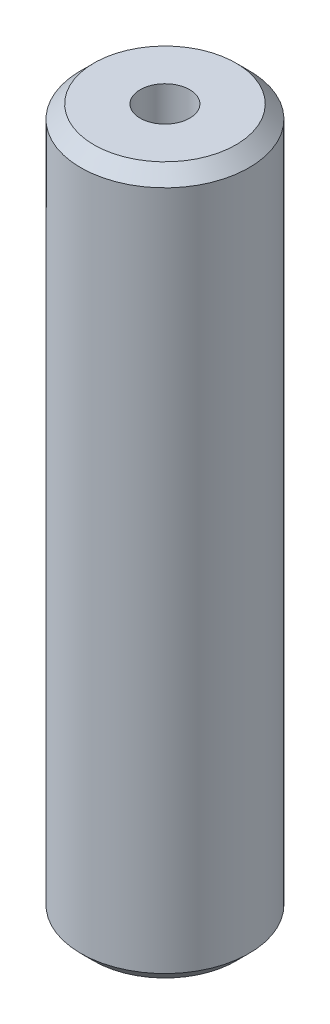
from build123d import *

# Parameters (mm, degrees)
SKETCH1_R           = 15
BOSS_EXTRUDE1_DEPTH = 126.003839894
SKETCH2_R           = 4.41232142
CUT_EXTRUDE1_DEPTH  = 128.77702324
CHAMFER1_SIZE       = 2.352460863


with BuildPart() as part:
    # Sketch1 → Boss-Extrude1 (new body)
    with BuildSketch(Plane(origin=(0, 0, 0), x_dir=(1, 0, 0), z_dir=(0, 1, 0))):
        Circle(SKETCH1_R)
    extrude(amount=BOSS_EXTRUDE1_DEPTH)

    # Sketch2 → Cut-Extrude1 (cut, through all)
    with BuildSketch(Plane(origin=(0, 0, 0), x_dir=(1, 0, 0), z_dir=(0, 1, 0))):
        Circle(SKETCH2_R)
    extrude(amount=CUT_EXTRUDE1_DEPTH, mode=Mode.SUBTRACT)

    # Chamfer1
    chamfer1_edges = [part.edges().sort_by_distance(p)[0] for p in [
        (-15, 126.003839894, 0),
        (-15, 0, 0),
    ]]
    chamfer(chamfer1_edges, length=CHAMFER1_SIZE)


solid = part.part
